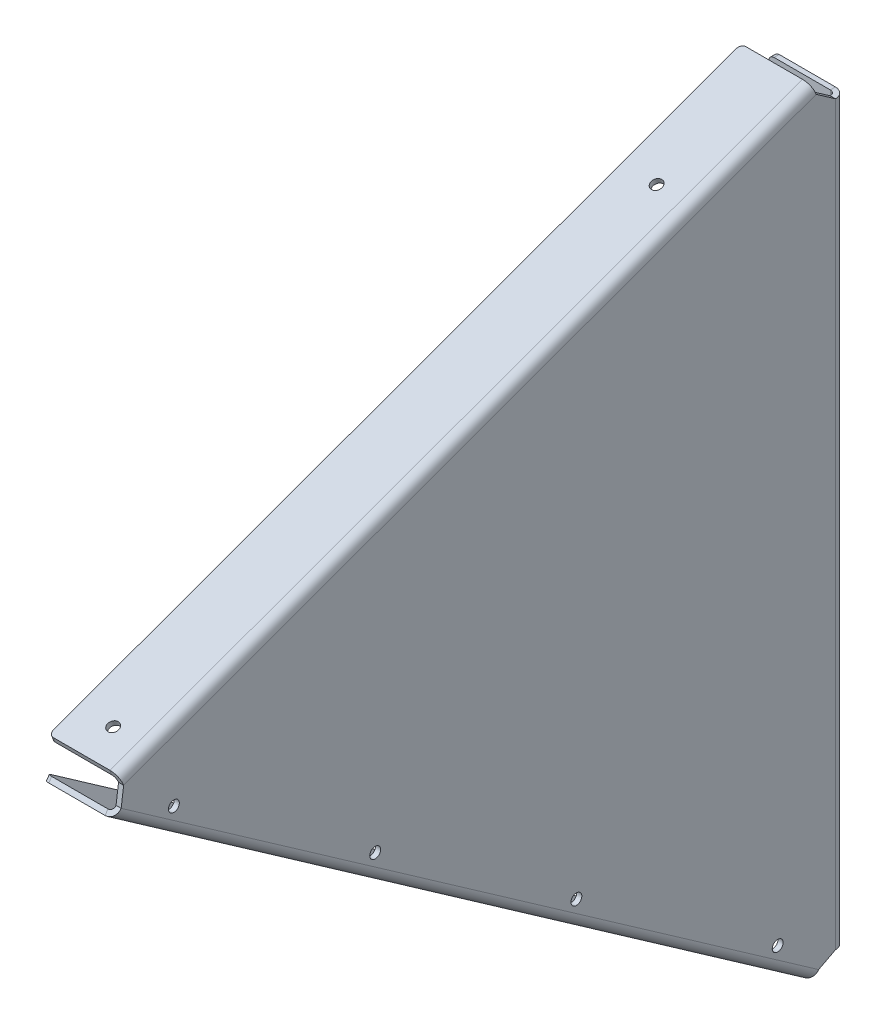
from build123d import *

# Parameters (mm, degrees)
BASE_FLANGE1_DEPTH                   = 3.175
EDGE_FLANGE1_DEPTH                   = 528.215976366
EDGE_FLANGE1_BEND_DEPTH              = 457.2
EDGE_FLANGE1_BEND_2_DEPTH            = 457.2
F_17_64_0_26563_DIAMETER_HOLE1_D     = 6.747002
F_17_64_0_26563_DIAMETER_HOLE1_DEPTH = 3.175
F_17_64_0_26563_DIAMETER_HOLE1_TIP   = 2.027003899
F_17_64_0_26563_DIAMETER_HOLE2_D     = 6.747002
F_17_64_0_26563_DIAMETER_HOLE2_DEPTH = 3.175
F_17_64_0_26563_DIAMETER_HOLE2_TIP   = 2.027003899
FILLET1_R                            = 3.175
F_17_64_0_26563_DIAMETER_HOLE3_D     = 6.747002
F_17_64_0_26563_DIAMETER_HOLE3_DEPTH = 3.175
F_17_64_0_26563_DIAMETER_HOLE3_TIP   = 2.027003899
F_17_64_0_26563_DIAMETER_HOLE4_D     = 6.747002


# Sheet-metal steps are written as plain solids
with BuildPart() as part:
    # Sketch1 → Base-Flange1 (new body)
    with BuildSketch(Plane(origin=(0, 0, 0), x_dir=(0, 0, -1), z_dir=(1, 0, 0))):
        Polygon((0, 12.7), (0, 469.9), (-11.934096284, 478.25634418), (-441.561562507, 321.884734651), (-443.092427829, 310.256658089), (-10.403230962, 7.284420742), align=None)
    extrude(amount=-BASE_FLANGE1_DEPTH)

    # Edge-Flange1 section (across the edge) → Edge-Flange1 (add)
    with BuildSketch(Plane(origin=(-3.175, 4.683613001, 12.224336148), x_dir=(-3.4914813388431334e-15, 0.819152044288993, -0.5735764363510446), z_dir=(0, 0.5735764363510446, 0.819152044288993))):
        with BuildLine():
            Line((-3.175, 3.175), (-3.175, 41.275))
            Line((-3.175, 41.275), (0, 41.275))
            Line((0, 41.275), (0, 3.175))
            ThreePointArc((0, 3.175), (0.92993597, 0.92993597), (3.175, 0))
            Line((3.175, 0), (3.175, -3.175))
            ThreePointArc((3.175, -3.175), (-1.315128061, -1.315128061), (-3.175, 3.175))
        make_face()
    extrude(amount=EDGE_FLANGE1_DEPTH)

    # Edge-Flange1 section 2 (across the edge) → Edge-Flange1 bend (add)
    with BuildSketch(Plane(origin=(-3.175, 469.9, -3.175), x_dir=(0, 0, 1), z_dir=(0, -1, 0))):
        with BuildLine():
            Line((-3.175, 3.175), (-3.175, 41.275))
            Line((-3.175, 41.275), (0, 41.275))
            Line((0, 41.275), (0, 3.175))
            ThreePointArc((0, 3.175), (0.92993597, 0.92993597), (3.175, 0))
            Line((3.175, 0), (3.175, -3.175))
            ThreePointArc((3.175, -3.175), (-1.315128061, -1.315128061), (-3.175, 3.175))
        make_face()
    extrude(amount=EDGE_FLANGE1_BEND_DEPTH)

    # Edge-Flange1 section 3 (across the edge) → Edge-Flange1 bend 2 (add)
    with BuildSketch(Plane(origin=(-3.175, 324.868258722, 442.647476462), x_dir=(-3.4914813388431334e-15, -0.9396926207859071, -0.3420201433256725), z_dir=(0, 0.3420201433256725, -0.9396926207859071))):
        with BuildLine():
            Line((-3.175, 3.175), (-3.175, 41.275))
            Line((-3.175, 41.275), (0, 41.275))
            Line((0, 41.275), (0, 3.175))
            ThreePointArc((0, 3.175), (0.92993597, 0.92993597), (3.175, 0))
            Line((3.175, 0), (3.175, -3.175))
            ThreePointArc((3.175, -3.175), (-1.315128061, -1.315128061), (-3.175, 3.175))
        make_face()
    extrude(amount=EDGE_FLANGE1_BEND_2_DEPTH)

    # 17/64 (0.26563) Diameter Hole1
    with Locations(Plane(origin=(0, 0, -6.35), x_dir=(-1, 0, 0), z_dir=(0, 0, -1))):
        with Locations((22.225, 390.525), (22.225, 31.75)):
            Hole(F_17_64_0_26563_DIAMETER_HOLE1_D / 2, depth=F_17_64_0_26563_DIAMETER_HOLE1_DEPTH)
            with Locations((0, 0, -(F_17_64_0_26563_DIAMETER_HOLE1_DEPTH + F_17_64_0_26563_DIAMETER_HOLE1_TIP / 2))):  # 118° drill point
                Cone(0, F_17_64_0_26563_DIAMETER_HOLE1_D / 2, F_17_64_0_26563_DIAMETER_HOLE1_TIP, mode=Mode.SUBTRACT)

    # 17/64 (0.26563) Diameter Hole2
    with Locations(Plane(origin=(0, 432.113572267, 157.276478127), x_dir=(1, 0, 0), z_dir=(3.4475760670445246e-15, 0.939692620785907, 0.3420201433256725))):
        with Locations((-22.225, 72.983921169), (-22.225, -285.791078831)):
            Hole(F_17_64_0_26563_DIAMETER_HOLE2_D / 2, depth=F_17_64_0_26563_DIAMETER_HOLE2_DEPTH)
            with Locations((0, 0, -(F_17_64_0_26563_DIAMETER_HOLE2_DEPTH + F_17_64_0_26563_DIAMETER_HOLE2_TIP / 2))):  # 118° drill point
                Cone(0, F_17_64_0_26563_DIAMETER_HOLE2_D / 2, F_17_64_0_26563_DIAMETER_HOLE2_TIP, mode=Mode.SUBTRACT)

    # Fillet1
    fillet1_edges = [part.edges().sort_by_distance(p)[0] for p in [
        (-44.45, 3.383209131, 13.134888741),
        (-44.45, 306.355446478, 445.824085607),
        (-44.45, 469.9, -4.7625),
        (-44.45, 12.7, -4.7625),
        (-44.45, 326.360020758, 443.19043344),
        (-44.45, 482.731630286, 13.562967217),
    ]]
    fillet(fillet1_edges, radius=FILLET1_R)

    # 17/64 (0.26563) Diameter Hole3
    with Locations(Plane(origin=(0, -5.201615481, 3.642210371), x_dir=(-1, 0, 0), z_dir=(2.9747797534781195e-15, -0.819152044288993, 0.5735764363510445))):
        with Locations((22.225, -48.207988183), (22.225, -200.607988183), (22.225, -353.007988183), (22.225, -505.407988183)):
            Hole(F_17_64_0_26563_DIAMETER_HOLE3_D / 2, depth=F_17_64_0_26563_DIAMETER_HOLE3_DEPTH)
            with Locations((0, 0, -(F_17_64_0_26563_DIAMETER_HOLE3_DEPTH + F_17_64_0_26563_DIAMETER_HOLE3_TIP / 2))):  # 118° drill point
                Cone(0, F_17_64_0_26563_DIAMETER_HOLE3_D / 2, F_17_64_0_26563_DIAMETER_HOLE3_TIP, mode=Mode.SUBTRACT)

    # 17/64 (0.26563) Diameter Hole4 (through all)
    with Locations(Plane(origin=(0, 0, 0), x_dir=(0, 0, -1), z_dir=(1, 0, 0))):
        with Locations((-410.363776349, 295.091728247), (-285.5250048, 207.678679347), (-160.68623325, 120.265630447), (-35.8474617, 32.852581547)):
            Hole(F_17_64_0_26563_DIAMETER_HOLE4_D / 2)


solid = part.part
